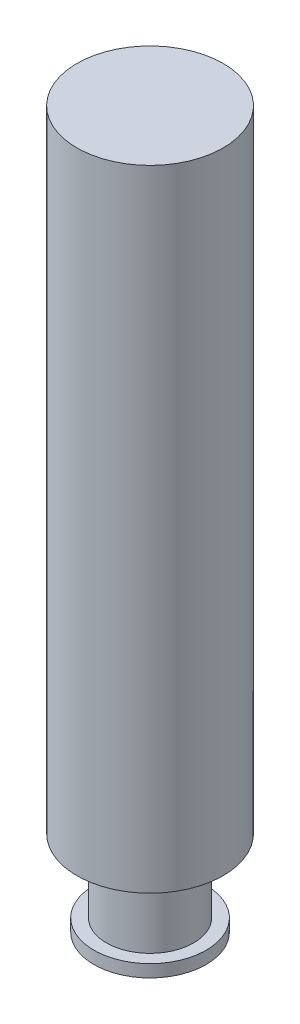
from build123d import *


with BuildPart() as part:
    # Sketch1 → Revolve1 (revolve)
    with BuildSketch(Plane(origin=(-15.274866536, 30.214562676, 34.370224199), x_dir=(-0.6512940792251927, 0, 0.758825422851797), z_dir=(0.758825422851797, 0, 0.6512940792251927))):
        Polygon((0.538461916, -0.016033073), (-0.794313715, -0.016033073), (-0.794313715, 12.79633963), (-0.794313715, 13.022686392), (0.228391261, 13.022686392), (0.228391261, 12.79633963), (-0.000563715, 12.79633963), (-0.000563715, 11.466008099), (0.538461916, 11.466008099), align=None)
    revolve(axis=Axis((-14.757534716, 30.388216029, 33.767478758), (0, 1, 0)))


solid = part.part
